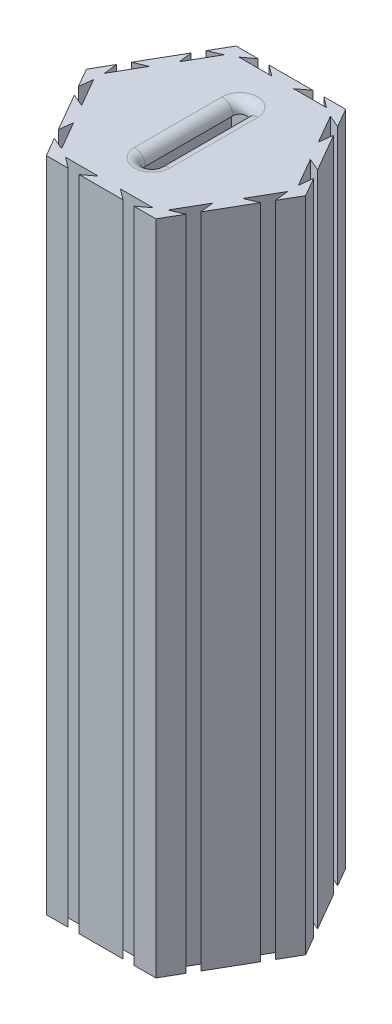
from build123d import *

# Parameters (mm, degrees)
BOSS_EXTRUDE1_DEPTH = 240
SHELL1_T            = 4
CUT_EXTRUDE1_DEPTH  = 246.764114549
CUT_EXTRUDE2_REACH  = 247.764
FILLET1_R           = 4


with BuildPart() as part:
    # Sketch1 → Boss-Extrude1 (new body)
    with BuildSketch(Plane(origin=(0, 0, 0), x_dir=(1, 0, 0), z_dir=(0, 1, 0))):
        Polygon((40, 0), (20, 34.641016151), (-20, 34.641016151), (-40, 0), (-20, -34.641016151), (20, -34.641016151), align=None)
    extrude(amount=BOSS_EXTRUDE1_DEPTH)

    # Shell1 (no face opened: a closed hollow body)
    add(offset(amount=-SHELL1_T, mode=Mode.PRIVATE), mode=Mode.SUBTRACT)

    # Sketch2 → Cut-Extrude1 (cut, through all)
    with BuildSketch(Plane.XZ):
        Polygon((-19.401923789, 29.676914536), (-24, 27.712812921), (-26, 24.248711306), (-25.401923789, 19.284609691), align=None)
        Polygon((16, 31.641016151), (12, 34.641016151), (8, 34.641016151), (4, 31.641016151), align=None)
        Polygon((26, 24.248711306), (24, 27.712812921), (19.401923789, 29.676914536), (25.401923789, 19.284609691), align=None)
        Polygon((35.401923789, 1.964101615), (36, 6.92820323), (34, 10.392304845), (29.401923789, 12.356406461), align=None)
        Polygon((34, -10.392304845), (36, -6.92820323), (35.401923789, -1.964101615), (29.401923789, -12.356406461), align=None)
        Polygon((19.401923789, -29.676914536), (24, -27.712812921), (26, -24.248711306), (25.401923789, -19.284609691), align=None)
        Polygon((8, -34.641016151), (12, -34.641016151), (16, -31.641016151), (4, -31.641016151), align=None)
        Polygon((-16, -31.641016151), (-12, -34.641016151), (-8, -34.641016151), (-4, -31.641016151), align=None)
        Polygon((-26, -24.248711306), (-24, -27.712812921), (-19.401923789, -29.676914536), (-25.401923789, -19.284609691), align=None)
        Polygon((-35.401923789, -1.964101615), (-36, -6.92820323), (-34, -10.392304845), (-29.401923789, -12.356406461), align=None)
        Polygon((-34, 10.392304845), (-36, 6.92820323), (-35.401923789, 1.964101615), (-29.401923789, 12.356406461), align=None)
        Polygon((-16, 31.641016151), (-4, 31.641016151), (-8, 34.641016151), (-12, 34.641016151), align=None)
    extrude(amount=-CUT_EXTRUDE1_DEPTH, mode=Mode.SUBTRACT)

    # Sketch3 → Cut-Extrude2 (cut, up to next)
    with BuildSketch(Plane(origin=(0, 240, 0), x_dir=(1, 0, 0), z_dir=(0, 1, 0)), mode=Mode.PRIVATE) as cut_extrude2_sk1:
        with BuildLine():
            Line((2.5, 16), (2.5, -16))
            ThreePointArc((2.5, -16), (0, -18.5), (-2.5, -16))
            Line((-2.5, -16), (-2.5, 16))
            ThreePointArc((-2.5, 16), (0, 18.5), (2.5, 16))
        make_face()
    cut_extrude2_tool1 = extrude(cut_extrude2_sk1.sketch, amount=-CUT_EXTRUDE2_REACH, mode=Mode.PRIVATE) & part.part
    add(cut_extrude2_tool1.solids().sort_by_distance((0, 240, 0))[0], mode=Mode.SUBTRACT)

    # Fillet1
    fillet1_edges = [part.edges().sort_by_distance(p)[0] for p in [
        (0, 240, -18.5),
        (-2.5, 240, 0),
        (0, 240, 18.5),
        (2.5, 240, 0),
    ]]
    fillet(fillet1_edges, radius=FILLET1_R - 0.0001)  # a hair under: the kernel refuses the full size


solid = part.part
